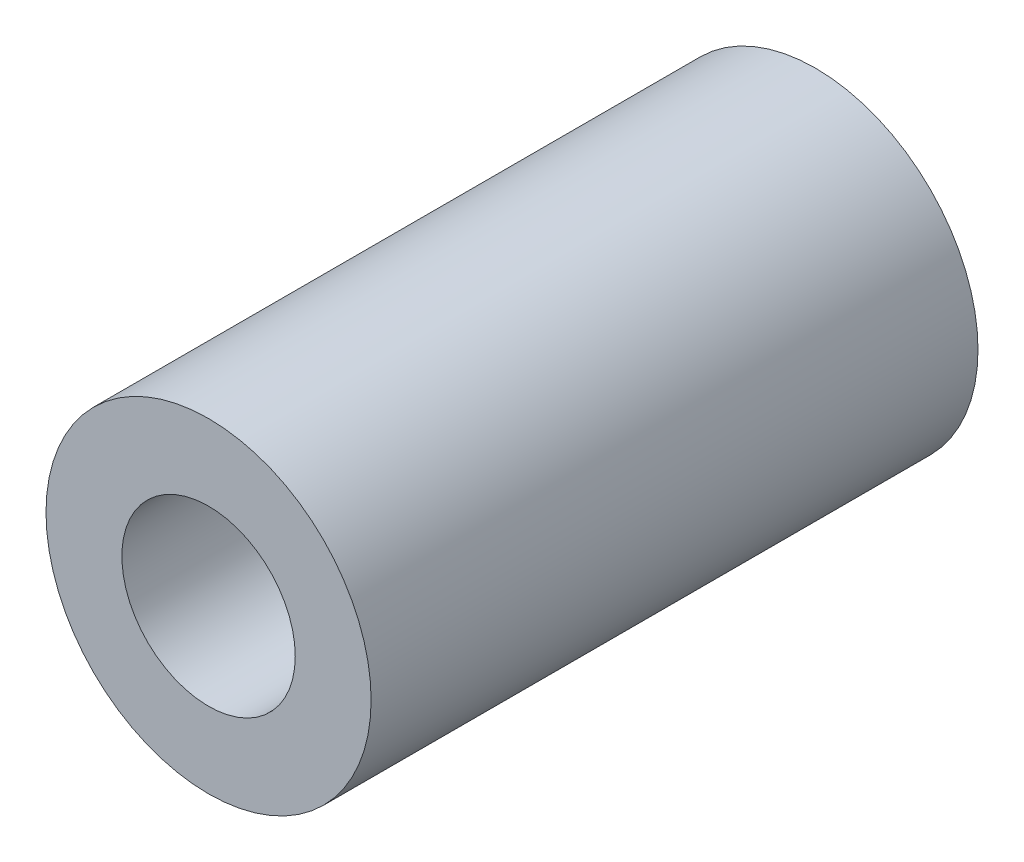
from build123d import *

# Parameters (mm, degrees)
SKETCH2_R           = 2
BOSS_EXTRUDE1_DEPTH = 4
SKETCH3_R           = 2
CUT_EXTRUDE1_DEPTH  = 4
SKETCH4_R           = 3
CUT_EXTRUDE2_DEPTH  = 2
SKETCH5_R           = 3.75
SKETCH5_R_2         = 2
BOSS_EXTRUDE2_DEPTH = 10


with BuildPart() as part:
    # Sketch2 → Boss-Extrude1 (new body)
    with BuildSketch(Plane.XY):
        with BuildLine():
            Line((1.348357032, -93.348542262), (7.005211484, -87.691688216))
            ThreePointArc((7.005211484, -87.691688216), (12.308512224, -87.691688287), (12.308512391, -92.994989027))
            Line((12.308512391, -92.994989027), (6.651658446, -98.651843581))
            ThreePointArc((6.651658446, -98.651843581), (1.348356961, -98.651843747), (1.348357032, -93.348542262))
        make_face()
        with Locations((9.656861819, -90.34333874)):
            Circle(SKETCH2_R, mode=Mode.SUBTRACT)
    extrude(amount=BOSS_EXTRUDE1_DEPTH)

    # Sketch3 → Cut-Extrude1 (cut)
    with BuildSketch(Plane.XY.offset(4)):
        with Locations((4.00000762, -96.00019304)):
            Circle(SKETCH3_R)
    extrude(amount=-CUT_EXTRUDE1_DEPTH, mode=Mode.SUBTRACT)

    # Sketch4 → Cut-Extrude2 (cut)
    with BuildSketch(Plane.XY.offset(4)):
        with Locations((4.00000762, -96.00019304)):
            Circle(SKETCH4_R)
    extrude(amount=-CUT_EXTRUDE2_DEPTH, mode=Mode.SUBTRACT)

    # Sketch5 → Boss-Extrude2 (add)
    with BuildSketch(Plane.XY.offset(4)):
        with Locations((9.656861819, -90.34333874)):
            Circle(SKETCH5_R)
        with Locations((9.656861819, -90.34333874)):
            Circle(SKETCH5_R_2, mode=Mode.SUBTRACT)
    extrude(amount=BOSS_EXTRUDE2_DEPTH)


solid = part.part
